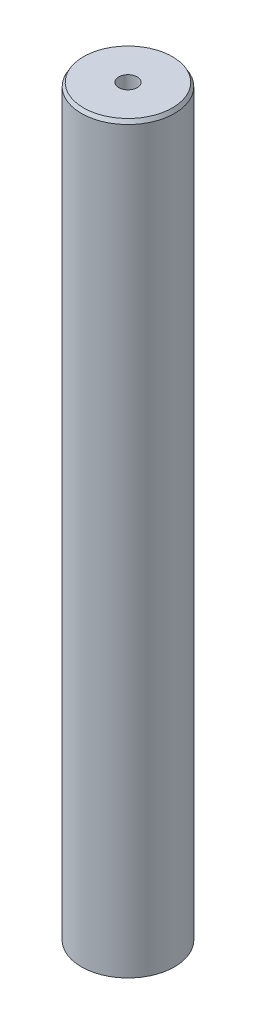
from build123d import *
from OCP.BRepFilletAPI import BRepFilletAPI_MakeChamfer

# Parameters (mm, degrees)
SKETCH1_R           = 25
BOSS_EXTRUDE1_DEPTH = 400
SKETCH2_R           = 5
CUT_EXTRUDE1_DEPTH  = 402.559460105
CHAMFER1_SIZE       = 2
CHAMFER1_SIZE2      = 1.154700538


with BuildPart() as part:
    # Sketch1 → Boss-Extrude1 (new body)
    with BuildSketch(Plane(origin=(0, 0, 0), x_dir=(1, 0, 0), z_dir=(0, 1, 0))):
        Circle(SKETCH1_R)
    extrude(amount=BOSS_EXTRUDE1_DEPTH)

    # Sketch2 → Cut-Extrude1 (cut, through all)
    with BuildSketch(Plane(origin=(0, 0, 0), x_dir=(1, 0, 0), z_dir=(0, 1, 0))):
        Circle(SKETCH2_R)
    extrude(amount=CUT_EXTRUDE1_DEPTH, mode=Mode.SUBTRACT)

    # Chamfer1: one chamfer whose edges measure the first distance from different faces: ONE call of the kernel's chamfer builder (chamfer() names one face for all edges)
    chamfer1_edges_1 = [part.edges().sort_by_distance(p)[0] for p in [
        (-25, 400, 0),
    ]]
    chamfer1_side_1 = [part.faces().sort_by_distance(p)[0] for p in [
        (-25, 200, 0),
    ]]
    chamfer1_edges_2 = [part.edges().sort_by_distance(p)[0] for p in [
        (-25, 0, 0),
    ]]
    chamfer1_side_2 = [part.faces().sort_by_distance(p)[0] for p in [
        (-24.292893219, 0, 0),
    ]]
    chamfer1 = BRepFilletAPI_MakeChamfer(part.part.solid().wrapped)
    for e in chamfer1_edges_1:
        chamfer1.Add(CHAMFER1_SIZE, CHAMFER1_SIZE2, e.wrapped, chamfer1_side_1[0].wrapped)  # the first distance lies on this face
    for e in chamfer1_edges_2:
        chamfer1.Add(CHAMFER1_SIZE, CHAMFER1_SIZE2, e.wrapped, chamfer1_side_2[0].wrapped)  # the first distance lies on this face
    add(Compound.cast(chamfer1.Shape()), mode=Mode.REPLACE)


solid = part.part
